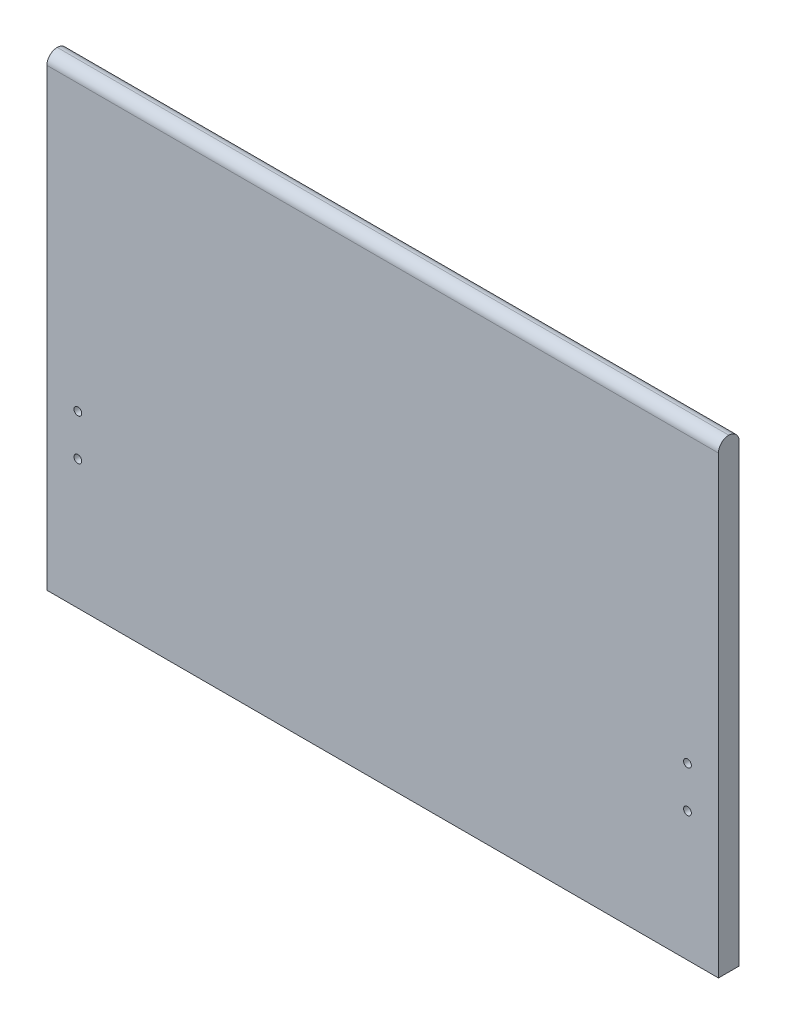
from build123d import *

# Parameters (mm, degrees)
SCHIZZO1_W                   = 1300
SCHIZZO1_H                   = 900
ESTRUSIONE_ESTRUSIONE1_DEPTH = 40
RACCORDO1_R                  = 20
SCHIZZO2_R                   = 7.5
TAGLIO_ESTRUSIONE1_DEPTH     = 30


with BuildPart() as part:
    # Schizzo1 → Estrusione-Estrusione1 (new body)
    with BuildSketch(Plane.XY):
        with Locations((650, -450)):
            Rectangle(SCHIZZO1_W, SCHIZZO1_H)
    extrude(amount=ESTRUSIONE_ESTRUSIONE1_DEPTH)

    # Raccordo1
    raccordo1_edges = [part.edges().sort_by_distance(p)[0] for p in [
        (650, 0, 0),
        (650, 0, 40),
    ]]
    fillet(raccordo1_edges, radius=RACCORDO1_R - 0.0001)  # a hair under: the kernel refuses the full size

    # Schizzo2 → Taglio-Estrusione1 (cut)
    with BuildSketch(Plane.XY.offset(40)):
        with Locations((60, -650)):
            Circle(SCHIZZO2_R)
        with Locations((60, -570)):
            Circle(SCHIZZO2_R)
        with Locations((1240, -650)):
            Circle(SCHIZZO2_R)
        with Locations((1240, -570)):
            Circle(SCHIZZO2_R)
    extrude(amount=-TAGLIO_ESTRUSIONE1_DEPTH, mode=Mode.SUBTRACT)


solid = part.part
